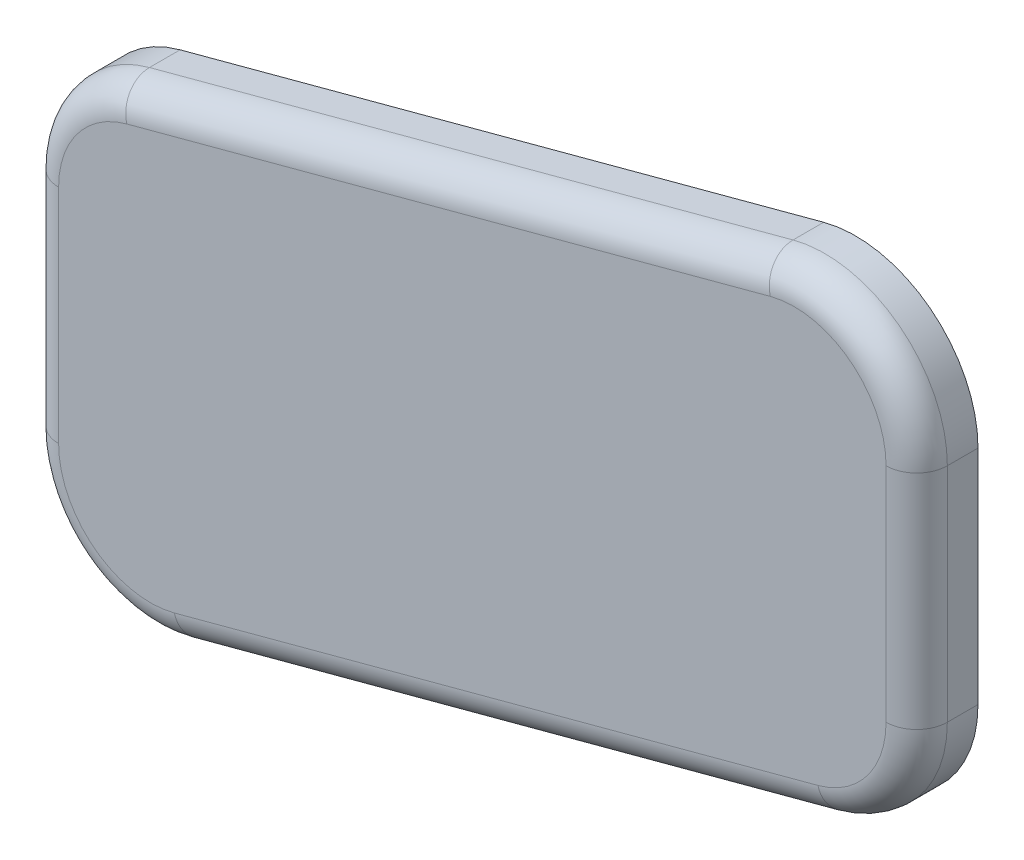
from build123d import *

# Parameters (mm, degrees)
EXTRUDE_1_DEPTH = 2
FILLET_1_R      = 4
FILLET_2_R      = 1


with BuildPart() as part:
    # Эскиз1 → Бобышка-Вытянуть1 (new body)
    with BuildSketch(Plane.XY):
        Polygon((0, 0), (29, 7.770526581), (29, 23.299669287), (0, 15.529142706), align=None)
    extrude(amount=EXTRUDE_1_DEPTH)

    # Скругление1
    fillet_1_edges = [part.edges().sort_by_distance(p)[0] for p in [
        (0, 15.529142706, 1),
        (0, 0, 1),
        (29, 7.770526581, 1),
        (29, 23.299669287, 1),
    ]]
    fillet(fillet_1_edges, radius=FILLET_1_R)

    # Скругление2
    fillet_2_edges = [part.edges().sort_by_distance(p)[0] for p in [
        (27.435045716, 21.260181156, 2),
        (29, 14.463301164, 2),
        (28.173413361, 8.404788816, 2),
        (15.53527618, 4.162664707, 2),
        (1.564954284, 2.03948813, 2),
        (0, 8.836368123, 2),
        (0.826586639, 14.89488047, 2),
        (13.46472382, 19.13700458, 2),
    ]]
    fillet(fillet_2_edges, radius=FILLET_2_R)


solid = part.part
